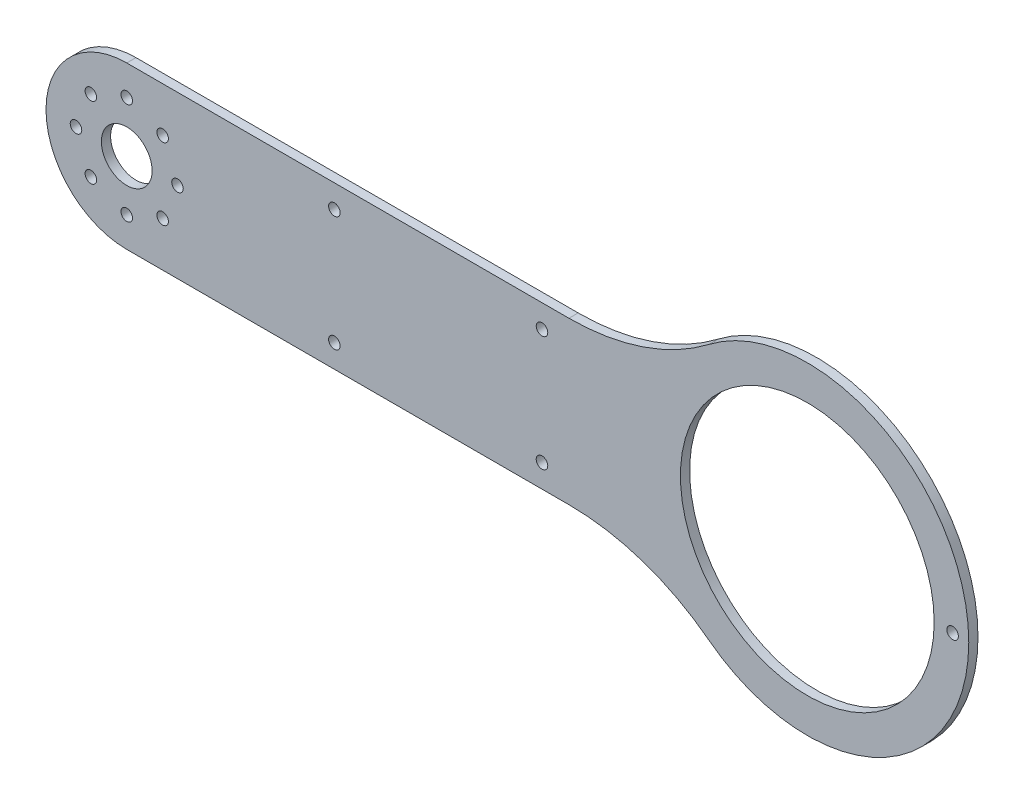
from build123d import *

# Parameters (mm, degrees)
ESBO_O1_R                = 27.5
ESBO_O1_R_2              = 5.5
ESBO_O1_R_3              = 1.25
RESSALTO_EXTRUS_O1_DEPTH = 2
FILETE1_R                = 17.5


with BuildPart() as part:
    # Esboço1 → Ressalto-extrusão1 (new body)
    with BuildSketch(Plane.XY):
        with BuildLine():
            Line((-165, 17.5), (-165, -17.5))
            Line((-165, -17.5), (-51.659945799, -17.5))
            ThreePointArc((-51.659945799, -17.5), (-35.617722101, -20.143405329), (-21.271742388, -27.794117647))
            ThreePointArc((-21.271742388, -27.794117647), (35, 0), (-21.271742388, 27.794117647))
            ThreePointArc((-21.271742388, 27.794117647), (-35.617722101, 20.143405329), (-51.659945799, 17.5))
            Line((-51.659945799, 17.5), (-165, 17.5))
        make_face()
        Circle(ESBO_O1_R, mode=Mode.SUBTRACT)
        with Locations((-147.5, 0)):
            Circle(ESBO_O1_R_2, mode=Mode.SUBTRACT)
        with Locations((-147.5, 11)):
            Circle(ESBO_O1_R_3, mode=Mode.SUBTRACT)
        with Locations((-139.721825407, 7.778174593)):
            Circle(ESBO_O1_R_3, mode=Mode.SUBTRACT)
        with Locations((-136.5, 0)):
            Circle(ESBO_O1_R_3, mode=Mode.SUBTRACT)
        with Locations((-139.721825407, -7.778174593)):
            Circle(ESBO_O1_R_3, mode=Mode.SUBTRACT)
        with Locations((-147.5, -11)):
            Circle(ESBO_O1_R_3, mode=Mode.SUBTRACT)
        with Locations((-155.278174593, -7.778174593)):
            Circle(ESBO_O1_R_3, mode=Mode.SUBTRACT)
        with Locations((-158.5, 0)):
            Circle(ESBO_O1_R_3, mode=Mode.SUBTRACT)
        with Locations((-155.278174593, 7.778174593)):
            Circle(ESBO_O1_R_3, mode=Mode.SUBTRACT)
        with Locations((31.5, 0)):
            Circle(ESBO_O1_R_3, mode=Mode.SUBTRACT)
        with Locations((-57.5, 12.5)):
            Circle(ESBO_O1_R_3, mode=Mode.SUBTRACT)
        with Locations((-102.5, 12.5)):
            Circle(ESBO_O1_R_3, mode=Mode.SUBTRACT)
        with Locations((-102.5, -12.5)):
            Circle(ESBO_O1_R_3, mode=Mode.SUBTRACT)
        with Locations((-57.5, -12.5)):
            Circle(ESBO_O1_R_3, mode=Mode.SUBTRACT)
    extrude(amount=RESSALTO_EXTRUS_O1_DEPTH)

    # Filete1
    filete1_edges = [part.edges().sort_by_distance(p)[0] for p in [
        (-165, -17.5, 1),
        (-165, 17.5, 1),
    ]]
    fillet(filete1_edges, radius=FILETE1_R - 0.0001)  # a hair under: the kernel refuses the full size


solid = part.part
